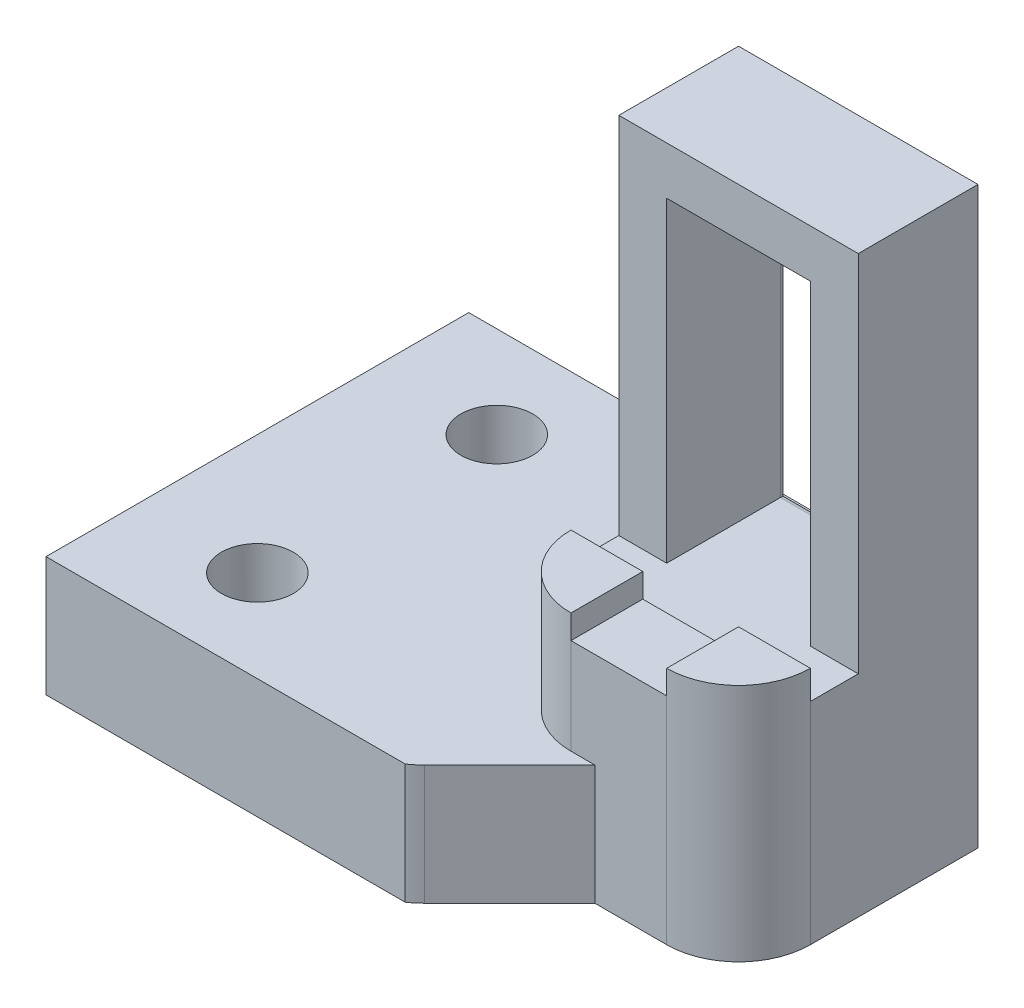
from build123d import *

# Parameters (mm, degrees)
EXTRUDE_1_DEPTH      = 4
SKETCH_2_W           = 10
SKETCH_2_H           = 15
EXTRUDE_2_DEPTH      = 20
SKETCH_3_R           = 1.45
CUT_EXTRUDE_1_DEPTH  = 20
SKETCH_4_W           = 6
SKETCH_4_H           = 13.2
CUT_EXTRUDE_2_DEPTH  = 9.5
SKETCH_6_R           = 0.75
CUT_EXTRUDE_4_DEPTH  = 3.5
SKETCH_7_W           = 10
SKETCH_7_H           = 24
CUT_EXTRUDE_5_DEPTH  = 5
SKETCH_9_W           = 3
SKETCH_9_H           = 12
CUT_EXTRUDE_6_DEPTH  = 10
SKETCH_11_W          = 1.5
SKETCH_11_H          = 12
CUT_EXTRUDE_7_DEPTH  = 10
CUT_EXTRUDE_8_REACH  = 41.699
SKETCH_13_W          = 10
SKETCH_13_H          = 5
SKETCH_19_W          = 10
SKETCH_19_H          = 2.4
EXTRUDE_6_DEPTH      = 4.8
SKETCH_20_W          = 10
SKETCH_20_H          = 2.6
EXTRUDE_7_DEPTH      = 6
FILLET_17_R          = 0.25
SKETCH_21_W          = 4
SKETCH_21_H          = 1
CUT_EXTRUDE_9_DEPTH  = 5.2
EXTRUDE_8_DEPTH      = 0.4
EXTRUDE_START        = 1
SKETCH_29_W          = 10
SKETCH_29_H          = 10
SKETCH_29_R          = 1.45
EXTRUDE_9_DEPTH      = 1
SKETCH_36_W          = 10
SKETCH_36_H          = 10
CUT_EXTRUDE_10_DEPTH = 10
SKETCH_38_W          = 10
SKETCH_38_H          = 5
EXTRUDE_10_DEPTH     = 20
SKETCH_39_W          = 10
SKETCH_39_H          = 5
EXTRUDE_11_DEPTH     = 10
SKETCH_40_R          = 1.5
CUT_EXTRUDE_11_DEPTH = 15
CHAMFER_1_SIZE       = 4
SKETCH_46_W          = 40
SKETCH_46_H          = 5
EXTRUDE_12_DEPTH     = 32
SKETCH_47_R          = 1.5
CUT_EXTRUDE_12_DEPTH = 10
SKETCH_48_W          = 24
SKETCH_48_H          = 16
SKETCH_48_H_2        = 6.075719237
CUT_EXTRUDE_13_DEPTH = 10
EXTRUDE_13_DEPTH     = 5
CHAMFER_2_SIZE       = 6
FILLET_18_R          = 3
CUT_EXTRUDE_14_DEPTH = 10
SKETCH_55_W          = 17.654819926
SKETCH_55_H          = 5
EXTRUDE_14_DEPTH     = 25
SKETCH_60_W          = 17.654819926
SKETCH_60_H          = 5
CUT_EXTRUDE_15_DEPTH = 10
SKETCH_61_R          = 1.5
CUT_EXTRUDE_16_DEPTH = 10
SKETCH_66_W          = 4.869638013
SKETCH_66_H          = 4.33889787
CUT_EXTRUDE_17_DEPTH = 14


with BuildPart() as part:
    # 草图1 → 凸台-拉伸1 (new body)
    with BuildSketch(Plane(origin=(0, 0, 0), x_dir=(1, 0, 0), z_dir=(0, 1, 0))):
        Polygon((-20, 0), (-20, -5), (-10, -5), (-10, 0), (0, 0), (0, 10), (-30, 10), (-30, 0), align=None)
    extrude(amount=EXTRUDE_1_DEPTH)

    # 草图2 → 凸台-拉伸2 (add)
    with BuildSketch(Plane(origin=(0, 4, 0), x_dir=(1, 0, 0), z_dir=(0, 1, 0))):
        with Locations((-15, 2.5)):
            Rectangle(SKETCH_2_W, SKETCH_2_H)
    extrude(amount=EXTRUDE_2_DEPTH)

    # 草图3 → 切除-拉伸1 (cut)
    with BuildSketch(Plane(origin=(0, 4, 0), x_dir=(1, 0, 0), z_dir=(0, 1, 0))):
        with Locations(Location((-5, 5, 0), (0, 0, 270))):
            Circle(SKETCH_3_R)
    extrude(amount=-CUT_EXTRUDE_1_DEPTH, mode=Mode.SUBTRACT)

    # 草图4 → 切除-拉伸2 (cut)
    with BuildSketch(Plane(origin=(0, 0, -10), x_dir=(-1, 0, 0), z_dir=(0, 0, -1))):
        with Locations((15, 15.4)):
            Rectangle(SKETCH_4_W, SKETCH_4_H)
    extrude(amount=-CUT_EXTRUDE_2_DEPTH, mode=Mode.SUBTRACT)

    # 草图6 → 切除-拉伸4 (cut)
    with BuildSketch(Plane(origin=(0, 0, -0.5), x_dir=(-1, 0, 0), z_dir=(0, 0, -1))):
        with Locations((15, 20.68)):
            Circle(SKETCH_6_R)
        with Locations((15, 10.52)):
            Circle(SKETCH_6_R)
        with Locations((15, 15.6)):
            Circle(SKETCH_6_R)
    extrude(amount=-CUT_EXTRUDE_4_DEPTH, mode=Mode.SUBTRACT)

    # 草图7 → 切除-拉伸5 (cut)
    with BuildSketch(Plane.XY.offset(5)):
        with Locations((-15, 12)):
            Rectangle(SKETCH_7_W, SKETCH_7_H)
    extrude(amount=-CUT_EXTRUDE_5_DEPTH, mode=Mode.SUBTRACT)

    # 草图9 → 切除-拉伸6 (cut)
    with BuildSketch(Plane(origin=(0, 0, -0.5), x_dir=(-1, 0, 0), z_dir=(0, 0, -1))):
        with Locations((15, 15.6)):
            Rectangle(SKETCH_9_W, SKETCH_9_H)
    extrude(amount=-CUT_EXTRUDE_6_DEPTH, mode=Mode.SUBTRACT)

    # 草图11 → 切除-拉伸7 (cut)
    with BuildSketch(Plane(origin=(0, 0, -0.5), x_dir=(-1, 0, 0), z_dir=(0, 0, -1))):
        with Locations((17.25, 15.6)):
            Rectangle(SKETCH_11_W, SKETCH_11_H)
        with Locations((12.75, 15.6)):
            Rectangle(SKETCH_11_W, SKETCH_11_H)
    extrude(amount=-CUT_EXTRUDE_7_DEPTH, mode=Mode.SUBTRACT)

    # 切除-拉伸8: up to this face of the body (flat: up to its plane)
    cut_extrude_8_end = Plane(part.part.faces().sort_by_distance((-5, 4, -9.858578644))[0])
    # 草图13 → 切除-拉伸8 (cut, up to the picked face)
    with BuildSketch(Plane(origin=(0, 24, 0), x_dir=(1, 0, 0), z_dir=(0, 1, 0)), mode=Mode.PRIVATE) as cut_extrude_8_sk1:
        with Locations((-15, 2.5)):
            Rectangle(SKETCH_13_W, SKETCH_13_H)
    cut_extrude_8_tool1 = split(extrude(cut_extrude_8_sk1.sketch, amount=-CUT_EXTRUDE_8_REACH, mode=Mode.PRIVATE), bisect_by=cut_extrude_8_end, keep=Keep.BOTH, mode=Mode.PRIVATE)
    add(cut_extrude_8_tool1.solids().sort_by(Axis((-15, 24, -2.5), (0, -1, 0)))[0], mode=Mode.SUBTRACT)

    # 草图19 → 凸台-拉伸6 (add)
    with BuildSketch(Plane(origin=(0, 4, 0), x_dir=(1, 0, 0), z_dir=(0, 1, 0))):
        with Locations((-15, 3.8)):
            Rectangle(SKETCH_19_W, SKETCH_19_H)
    extrude(amount=EXTRUDE_6_DEPTH)

    # 草图20 → 凸台-拉伸7 (add)
    with BuildSketch(Plane(origin=(0, 4, 0), x_dir=(1, 0, 0), z_dir=(0, 1, 0))):
        with Locations((-15, 1.3)):
            Rectangle(SKETCH_20_W, SKETCH_20_H)
    extrude(amount=EXTRUDE_7_DEPTH)

    # 圆角17
    fillet_17_edges = [part.edges().sort_by_distance(p)[0] for p in [
        (-12, 15.4, -10),
        (-15, 8.8, -10),
        (-18, 15.4, -10),
        (-15, 22, -10),
    ]]
    fillet(fillet_17_edges, radius=FILLET_17_R)

    # 草图21 → 切除-拉伸9 (cut)
    with BuildSketch(Plane.XY):
        with Locations((-15, 9.5)):
            Rectangle(SKETCH_21_W, SKETCH_21_H)
    extrude(amount=-CUT_EXTRUDE_9_DEPTH, mode=Mode.SUBTRACT)

    # 草图22 → 凸台-拉伸8 (add)
    with BuildSketch(Plane(origin=(0, 0, -2.6), x_dir=(-1, 0, 0), z_dir=(0, 0, -1))):
        Polygon((17, 9), (13, 9), (13, 10), (10, 10), (10, 8.8), (20, 8.8), (20, 10), (17, 10), align=None)
    extrude(amount=EXTRUDE_8_DEPTH)

    # 草图29 → 凸台-拉伸9 (add)
    # profile 1 of 2: a face of its own
    with BuildSketch(Plane(origin=(0, 4, 0), x_dir=(1, 0, 0), z_dir=(0, 1, 0)).offset(EXTRUDE_START)):
        with Locations((-25, 5)):
            Rectangle(SKETCH_29_W, SKETCH_29_H)
    # profile 2 of 2: a face of its own
    with BuildSketch(Plane(origin=(0, 4, 0), x_dir=(1, 0, 0), z_dir=(0, 1, 0)).offset(EXTRUDE_START)):
        with Locations((-5, 5)):
            Rectangle(SKETCH_29_W, SKETCH_29_H)
        with Locations(Location((-5, 5, 0), (0, 0, 270))):
            Circle(SKETCH_29_R, mode=Mode.SUBTRACT)
    extrude(amount=-EXTRUDE_9_DEPTH)

    # 草图36 → 切除-拉伸10 (cut)
    with BuildSketch(Plane(origin=(0, 5, 0), x_dir=(1, 0, 0), z_dir=(0, 1, 0))):
        with Locations((-5, 5)):
            Rectangle(SKETCH_36_W, SKETCH_36_H)
    extrude(amount=-CUT_EXTRUDE_10_DEPTH, mode=Mode.SUBTRACT)

    # 草图38 → 凸台-拉伸10 (add)
    with BuildSketch(Plane(origin=(0, 0, -10), x_dir=(-1, 0, 0), z_dir=(0, 0, -1))):
        with Locations((25, 2.5)):
            Rectangle(SKETCH_38_W, SKETCH_38_H)
    extrude(amount=EXTRUDE_10_DEPTH)

    # 草图39 → 凸台-拉伸11 (add)
    with BuildSketch(Plane.XY):
        with Locations((-25, 2.5)):
            Rectangle(SKETCH_39_W, SKETCH_39_H)
    extrude(amount=EXTRUDE_11_DEPTH)

    # 草图40 → 切除-拉伸11 (cut)
    with BuildSketch(Plane(origin=(0, 5, 0), x_dir=(1, 0, 0), z_dir=(0, 1, 0))):
        with Locations(Location((-25, 25, 0), (0, 0, 270))):
            Circle(SKETCH_40_R)
        with Locations(Location((-25, -5, 0), (0, 0, 270))):
            Circle(SKETCH_40_R)
    extrude(amount=-CUT_EXTRUDE_11_DEPTH, mode=Mode.SUBTRACT)

    # 倒角1
    # the kernel refuses this chamfer: 4 mm, written as the material it adds along each edge
    with BuildSketch(Plane(origin=(-20, 5, -10), x_dir=(1, 0, 0), z_dir=(0, -1, 0))) as chamfer_1_piece_1:
        Polygon((CHAMFER_1_SIZE, 0), (0, -CHAMFER_1_SIZE), (0, 0), align=None)
    extrude(amount=5)
    with BuildSketch(Plane(origin=(-20, 0, 0), x_dir=(0, 0, 1), z_dir=(0, 1, 0))) as chamfer_1_piece_2:
        Polygon((CHAMFER_1_SIZE, 0), (0, CHAMFER_1_SIZE), (0, 0), align=None)
    extrude(amount=5)

    # 草图46 → 凸台-拉伸12 (add)
    with BuildSketch(Plane.ZY.offset(30)):
        with Locations((-10, 2.5)):
            Rectangle(SKETCH_46_W, SKETCH_46_H)
    extrude(amount=EXTRUDE_12_DEPTH)

    # 草图47 → 切除-拉伸12 (cut)
    with BuildSketch(Plane(origin=(0, 5, 0), x_dir=(1, 0, 0), z_dir=(0, 1, 0))):
        with Locations(Location((-25, -5, 0), (0, 0, 270))):
            Circle(SKETCH_47_R)
        with Locations(Location((-25, 25, 0), (0, 0, 270))):
            Circle(SKETCH_47_R)
        with Locations(Location((-57, 25, 0), (0, 0, 270))):
            Circle(SKETCH_47_R)
        with Locations(Location((-57, -5, 0), (0, 0, 270))):
            Circle(SKETCH_47_R)
    extrude(amount=-CUT_EXTRUDE_12_DEPTH, mode=Mode.SUBTRACT)

    # 草图48 → 切除-拉伸13 (cut)
    with BuildSketch(Plane(origin=(0, 5, 0), x_dir=(1, 0, 0), z_dir=(0, 1, 0))):
        with Locations((-32, 22)):
            Rectangle(SKETCH_48_W, SKETCH_48_H)
        with Locations((-32, -6.962140382)):
            Rectangle(SKETCH_48_W, SKETCH_48_H_2)
    extrude(amount=-CUT_EXTRUDE_13_DEPTH, mode=Mode.SUBTRACT)

    # 草图49 → 凸台-拉伸13 (add)
    with BuildSketch(Plane(origin=(0, 5, 0), x_dir=(1, 0, 0), z_dir=(0, 1, 0))):
        with BuildLine():
            Line((-26.045384198, -3.924280763), (-23.954615802, -3.924280763))
            ThreePointArc((-23.954615802, -3.924280763), (-25, -3.5), (-26.045384198, -3.924280763))
        make_face()
    extrude(amount=-EXTRUDE_13_DEPTH)

    # 倒角2
    chamfer_2_edges = [part.edges().sort_by_distance(p)[0] for p in [
        (-44, 2.5, -14),
        (-44, 2.5, 3.924280763),
    ]]
    chamfer(chamfer_2_edges, length=CHAMFER_2_SIZE)

    # 圆角18
    # the kernel refuses this fillet: 3 mm, written as the material it takes off along each edge
    with BuildSketch(Plane(origin=(-20, 5, 0), x_dir=(0, 0, -1), z_dir=(0, 1, 0))) as fillet_18_piece_1:
        with BuildLine():
            CenterArc((FILLET_18_R, -FILLET_18_R), FILLET_18_R, 90, 90)
            Line((0, -FILLET_18_R), (0, 0))
            Line((0, 0), (FILLET_18_R, 0))
        make_face()
    extrude(amount=12.5, mode=Mode.SUBTRACT)
    with BuildSketch(Plane(origin=(-10, 17.5, 0), x_dir=(-1, 0, 0), z_dir=(0, -1, 0))) as fillet_18_piece_2:
        with BuildLine():
            CenterArc((FILLET_18_R, FILLET_18_R), FILLET_18_R, 180, 90)
            Line((0, FILLET_18_R), (0, 0))
            Line((0, 0), (FILLET_18_R, 0))
        make_face()
    extrude(amount=25, mode=Mode.SUBTRACT)
    with BuildSketch(Plane(origin=(-20, -1.544489496, 4), x_dir=(0.7071067811865482, 0, -0.7071067811865468), z_dir=(0, 1, 0))) as fillet_18_piece_3:
        with BuildLine():
            CenterArc((0.617795798, 3), FILLET_18_R, 259.158967285, 10.841032715)
            Line((0.053541586, 0.053541586), (0, 0))
            Line((0, 0), (0.617795798, 0))
        make_face()
    extrude(amount=8.088978992, mode=Mode.SUBTRACT)
    with BuildSketch(Plane(origin=(-20, 8.106601718, -14), x_dir=(-1, 0, 0), z_dir=(0, -1, 0))) as fillet_18_piece_4:
        with BuildLine():
            CenterArc((FILLET_18_R * 0.414213562373, -FILLET_18_R), FILLET_18_R, 90, 45)
            Line((-FILLET_18_R * 0.292893218813, -FILLET_18_R * 0.292893218813), (0, 0))
            Line((0, 0), (FILLET_18_R * 0.414213562373, 0))
        make_face()
    extrude(amount=11.213203436, mode=Mode.SUBTRACT)
    with BuildSketch(Plane(origin=(-44, 6.674406651, 10), x_dir=(-1, 0, 0), z_dir=(0, -1, 0))) as fillet_18_piece_5:
        with BuildLine():
            CenterArc((0.66976266, 3), FILLET_18_R, 257.099758761, 12.900241239)
            Line((0, 0.075719237), (0, 0))
            Line((0, 0), (0.66976266, 0))
        make_face()
    extrude(amount=8.348813302, mode=Mode.SUBTRACT)
    with BuildSketch(Plane(origin=(-62, -7.5, 10), x_dir=(0, 0, -1), z_dir=(0, 1, 0))) as fillet_18_piece_6:
        with BuildLine():
            CenterArc((FILLET_18_R, -FILLET_18_R), FILLET_18_R, 90, 90)
            Line((0, -FILLET_18_R), (0, 0))
            Line((0, 0), (FILLET_18_R, 0))
        make_face()
    extrude(amount=20, mode=Mode.SUBTRACT)
    with BuildSketch(Plane(origin=(-62, 12.5, -30), x_dir=(1, 0, 0), z_dir=(0, -1, 0)), Plane(origin=(-44, 12.5, -30), x_dir=(0, 0, 1), z_dir=(0, -1, 0))) as fillet_18_piece_7:
        with BuildLine():
            CenterArc((FILLET_18_R, FILLET_18_R), FILLET_18_R, 180, 90)
            Line((0, FILLET_18_R), (0, 0))
            Line((0, 0), (FILLET_18_R, 0))
        make_face()
    extrude(amount=20, mode=Mode.SUBTRACT)

    # 草图54 → 切除-拉伸14 (cut)
    with BuildSketch(Plane(origin=(0, 5, 0), x_dir=(1, 0, 0), z_dir=(0, 1, 0))):
        Polygon((-20, 3), (-20, 37.818871499), (-71.400493644, 37.818871499), (-71.400493644, 3), (-71.400493644, -21.76419116), (-20, -21.76419116), align=None)
    extrude(amount=-CUT_EXTRUDE_14_DEPTH, mode=Mode.SUBTRACT)

    # 草图55 → 凸台-拉伸14 (add)
    with BuildSketch(Plane.ZY.offset(20)):
        with Locations((-4.9031292, 2.5)):
            Rectangle(SKETCH_55_W, SKETCH_55_H)
    extrude(amount=EXTRUDE_14_DEPTH)

    # 草图60 → 切除-拉伸15 (cut)
    with BuildSketch(Plane.ZY.offset(45)):
        with Locations((-4.9031292, 2.5)):
            Rectangle(SKETCH_60_W, SKETCH_60_H)
    extrude(amount=-CUT_EXTRUDE_15_DEPTH, mode=Mode.SUBTRACT)

    # 草图61 → 切除-拉伸16 (cut)
    with BuildSketch(Plane(origin=(0, 5, 0), x_dir=(1, 0, 0), z_dir=(0, 1, 0))):
        with Locations(Location((-30, 9.9031292, 0), (0, 0, 270))):
            Circle(SKETCH_61_R)
        with Locations(Location((-30, -0.0968708, 0), (0, 0, 270))):
            Circle(SKETCH_61_R)
    extrude(amount=-CUT_EXTRUDE_16_DEPTH, mode=Mode.SUBTRACT)

    # 草图66 → 切除-拉伸17 (cut)
    with BuildSketch(Plane(origin=(0, 5, 0), x_dir=(1, 0, 0), z_dir=(0, 1, 0))):
        with Locations((-17.565180994, 12.169448935)):
            Rectangle(SKETCH_66_W, SKETCH_66_H)
    extrude(amount=-CUT_EXTRUDE_17_DEPTH, mode=Mode.SUBTRACT)


solid = part.part
